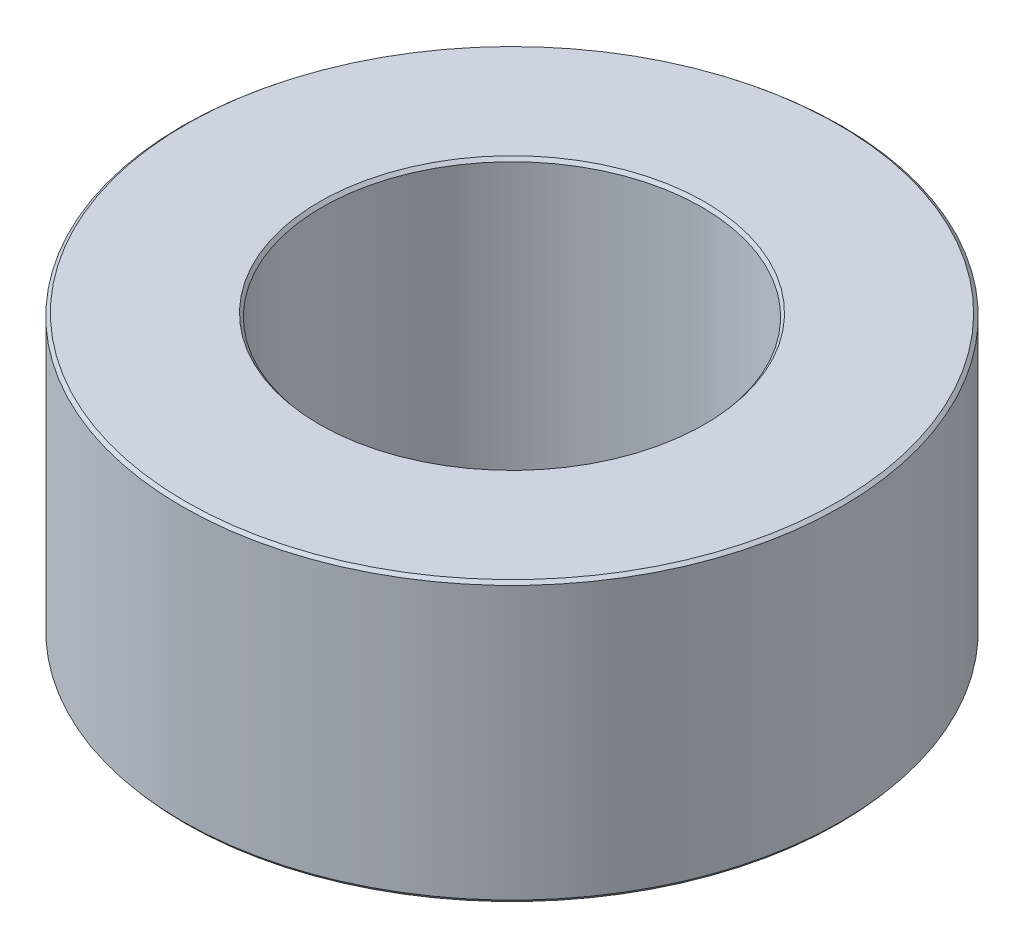
from build123d import *
from OCP.BRepFilletAPI import BRepFilletAPI_MakeChamfer

# Parameters (mm, degrees)
SKETCH1_R           = 37.5
BOSS_EXTRUDE1_DEPTH = 31.675196024
SKETCH2_R           = 21.607832295
CUT_EXTRUDE1_DEPTH  = 62.772308061
CHAMFER1_SIZE       = 0.313241846
CHAMFER1_SIZE2      = 0.371240718


with BuildPart() as part:
    # Sketch1 → Boss-Extrude1 (new body)
    with BuildSketch(Plane(origin=(0, 0, 0), x_dir=(1, 0, 0), z_dir=(0, 1, 0))):
        Circle(SKETCH1_R)
    extrude(amount=BOSS_EXTRUDE1_DEPTH)

    # Sketch2 → Cut-Extrude1 (cut, through all)
    with BuildSketch(Plane(origin=(0, 0, 0), x_dir=(1, 0, 0), z_dir=(0, 1, 0))):
        Circle(SKETCH2_R)
    extrude(amount=CUT_EXTRUDE1_DEPTH, mode=Mode.SUBTRACT)

    # Chamfer1: one chamfer whose edges measure the first distance from different faces: ONE call of the kernel's chamfer builder (chamfer() names one face for all edges)
    chamfer1_edges_1 = [part.edges().sort_by_distance(p)[0] for p in [
        (-21.607832295, 31.675196024, 0),
    ]]
    chamfer1_side_1 = [part.faces().sort_by_distance(p)[0] for p in [
        (-36.439339828, 31.675196024, 0),
    ]]
    chamfer1_edges_2 = [part.edges().sort_by_distance(p)[0] for p in [
        (-21.607832295, 0, 0),
    ]]
    chamfer1_side_2 = [part.faces().sort_by_distance(p)[0] for p in [
        (-21.607832295, 15.837598012, 0),
    ]]
    chamfer1_edges_3 = [part.edges().sort_by_distance(p)[0] for p in [
        (-37.5, 0, 0),
    ]]
    chamfer1_side_3 = [part.faces().sort_by_distance(p)[0] for p in [
        (-36.439339828, 0, 0),
    ]]
    chamfer1_edges_4 = [part.edges().sort_by_distance(p)[0] for p in [
        (-37.5, 31.675196024, 0),
    ]]
    chamfer1_side_4 = [part.faces().sort_by_distance(p)[0] for p in [
        (-37.5, 15.837598012, 0),
    ]]
    chamfer1 = BRepFilletAPI_MakeChamfer(part.part.solid().wrapped)
    for e in chamfer1_edges_1:
        chamfer1.Add(CHAMFER1_SIZE, CHAMFER1_SIZE2, e.wrapped, chamfer1_side_1[0].wrapped)  # the first distance lies on this face
    for e in chamfer1_edges_2:
        chamfer1.Add(CHAMFER1_SIZE, CHAMFER1_SIZE2, e.wrapped, chamfer1_side_2[0].wrapped)  # the first distance lies on this face
    for e in chamfer1_edges_3:
        chamfer1.Add(CHAMFER1_SIZE, CHAMFER1_SIZE2, e.wrapped, chamfer1_side_3[0].wrapped)  # the first distance lies on this face
    for e in chamfer1_edges_4:
        chamfer1.Add(CHAMFER1_SIZE, CHAMFER1_SIZE2, e.wrapped, chamfer1_side_4[0].wrapped)  # the first distance lies on this face
    add(Compound.cast(chamfer1.Shape()), mode=Mode.REPLACE)


solid = part.part
